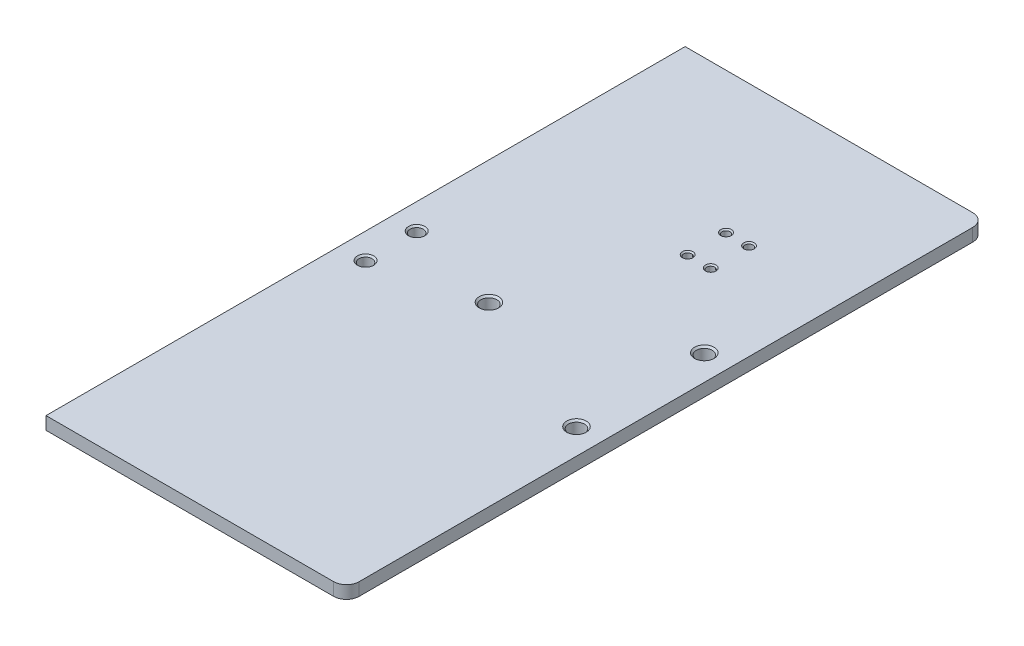
from build123d import *

# Parameters (mm, degrees)
SKETCH_1_W                     = 50
SKETCH_1_H                     = 100
EXTRUDE_1_DEPTH                = 2
SKETCH_2_W                     = 3
SKETCH_2_H                     = 100
EXTRUDE_2_DEPTH                = 80
SKETCH_3_W                     = 2
SKETCH_3_H                     = 66.7
EXTRUDE_3_DEPTH                = 70
CUT_EXTRUDE_4_REACH            = 162.465
SKETCH_8_W                     = 2
SKETCH_8_H                     = 66.7
EXTRUDE_4_DEPTH                = 70
CUT_EXTRUDE_5_REACH            = 140.25
HOLE_WIZARD_M3_1_D             = 2.5
HOLE_WIZARD_M3_1_DEPTH         = 2
HOLE_WIZARD_M3_1_CSINK_D       = 3.05
HOLE_WIZARD_M3_1_CSINK_ANGLE   = 90
FILLET_1_R                     = 2
CUT_EXTRUDE_6_REACH            = 140.25
SKETCH_12_R                    = 11
CUT_EXTRUDE_7_REACH            = 162.465
SKETCH_13_R                    = 14.5
SKETCH_14_W                    = 2
SKETCH_14_H                    = 66.7
EXTRUDE_5_DEPTH                = 70
CUT_EXTRUDE_8_REACH            = 156.14
SKETCH_15_R                    = 5.1
CUT_EXTRUDE_9_DEPTH            = 155.140358116
CUT_EXTRUDE_9_DEPTH_BACK       = 155.140358116
SKETCH_19_W                    = 2
SKETCH_19_H                    = 66.7
CUT_EXTRUDE_10_DEPTH           = 119.844436134
FILLET_2_R                     = 2
HOLE_WIZARD_M3_3_D             = 2.5
HOLE_WIZARD_M3_3_CSINK_D       = 3.05
HOLE_WIZARD_M3_3_CSINK_ANGLE   = 90
CUT_EXTRUDE_11_DEPTH           = 134.88427839
CUT_EXTRUDE_11_DEPTH_BACK      = 134.88427839
SKETCH_28_W                    = 73
SKETCH_28_H                    = 100
HOLE_WIZARD_M2_5_1_D           = 2.05
HOLE_WIZARD_M2_5_1_CSINK_D     = 2.55
HOLE_WIZARD_M2_5_1_CSINK_ANGLE = 90


# Read off the part's stored shape, not the designer's step: M1.6 螺纹孔1, M1.6 螺纹孔2
with BuildPart() as part:
    # 草图1 → 凸台-拉伸1 (new body)
    with BuildSketch(Plane(origin=(0, 0, 0), x_dir=(1, 0, 0), z_dir=(0, 1, 0))):
        Rectangle(SKETCH_1_W, SKETCH_1_H)
    extrude(amount=EXTRUDE_1_DEPTH)

    # 草图2 → 凸台-拉伸2 (add)
    with BuildSketch(Plane(origin=(0, 2, 0), x_dir=(1, 0, 0), z_dir=(0, 1, 0))):
        with Locations((-23.5, 0)):
            Rectangle(SKETCH_2_W, SKETCH_2_H)
    extrude(amount=EXTRUDE_2_DEPTH)

    # 草图3 → 凸台-拉伸3 (add)
    with BuildSketch(Plane.ZY.offset(25)):
        with Locations((-49, 48.65)):
            Rectangle(SKETCH_3_W, SKETCH_3_H)
    extrude(amount=EXTRUDE_3_DEPTH)

    # 草图4 → 切除-拉伸4 (cut, up to next)
    with BuildSketch(Plane(origin=(0, 0, -50), x_dir=(-1, 0, 0), z_dir=(0, 0, -1)), mode=Mode.PRIVATE) as cut_extrude_4_sk1:
        with BuildLine():
            Line((95, 82), (61.65, 82))
            ThreePointArc((61.65, 82), (85.232011153, 72.232011153), (95, 48.65))
            Line((95, 48.65), (95, 82))
        make_face()
    cut_extrude_4_tool1 = extrude(cut_extrude_4_sk1.sketch, amount=-CUT_EXTRUDE_4_REACH, mode=Mode.PRIVATE) & part.part
    # 草图4 → 切除-拉伸4 (cut, up to next)
    with BuildSketch(Plane(origin=(0, 0, -50), x_dir=(-1, 0, 0), z_dir=(0, 0, -1)), mode=Mode.PRIVATE) as cut_extrude_4_sk2:
        with BuildLine():
            ThreePointArc((95, 48.65), (85.232011153, 25.067988847), (61.65, 15.3))
            Line((61.65, 15.3), (95, 15.3))
            Line((95, 15.3), (95, 48.65))
        make_face()
    cut_extrude_4_tool2 = extrude(cut_extrude_4_sk2.sketch, amount=-CUT_EXTRUDE_4_REACH, mode=Mode.PRIVATE) & part.part
    add(cut_extrude_4_tool1.solids().sort_by_distance((-87.550679, 74.550679, -50))[0], mode=Mode.SUBTRACT)
    add(cut_extrude_4_tool2.solids().sort_by_distance((-87.550679, 22.749321, -50))[0], mode=Mode.SUBTRACT)

    # 草图8 → 凸台-拉伸4 (add)
    with BuildSketch(Plane.ZY.offset(25)):
        with Locations((7, 48.65)):
            Rectangle(SKETCH_8_W, SKETCH_8_H)
    extrude(amount=EXTRUDE_4_DEPTH)

    # 草图9 → 切除-拉伸5 (cut, up to next)
    with BuildSketch(Plane.XY.offset(8), mode=Mode.PRIVATE) as cut_extrude_5_sk1:
        with BuildLine():
            ThreePointArc((-95, 48.65), (-85.232011153, 72.232011153), (-61.65, 82))
            Line((-61.65, 82), (-95, 82))
            Line((-95, 82), (-95, 48.65))
        make_face()
    cut_extrude_5_tool1 = extrude(cut_extrude_5_sk1.sketch, amount=-CUT_EXTRUDE_5_REACH, mode=Mode.PRIVATE) & part.part
    # 草图9 → 切除-拉伸5 (cut, up to next)
    with BuildSketch(Plane.XY.offset(8), mode=Mode.PRIVATE) as cut_extrude_5_sk2:
        with BuildLine():
            ThreePointArc((-61.65, 15.3), (-85.232011153, 25.067988847), (-95, 48.65))
            Line((-95, 48.65), (-95, 15.3))
            Line((-95, 15.3), (-61.65, 15.3))
        make_face()
    cut_extrude_5_tool2 = extrude(cut_extrude_5_sk2.sketch, amount=-CUT_EXTRUDE_5_REACH, mode=Mode.PRIVATE) & part.part
    add(cut_extrude_5_tool1.solids().sort_by_distance((-87.550679, 74.550679, 8))[0], mode=Mode.SUBTRACT)
    add(cut_extrude_5_tool2.solids().sort_by_distance((-87.550679, 22.749321, 8))[0], mode=Mode.SUBTRACT)

    # M3 螺纹孔1
    with Locations(Plane.XY.offset(8)):
        with Locations((-78.970508076, 38.65), (-61.65, 68.65), (-44.329491924, 38.65)):
            CounterSinkHole(HOLE_WIZARD_M3_1_D / 2, HOLE_WIZARD_M3_1_CSINK_D / 2, depth=HOLE_WIZARD_M3_1_DEPTH, counter_sink_angle=HOLE_WIZARD_M3_1_CSINK_ANGLE)

    # 圆角1
    fillet_1_edges = [part.edges().sort_by_distance(p)[0] for p in [
        (-23.5, 82, 50),
        (25, 1, 50),
        (25, 1, -50),
    ]]
    fillet(fillet_1_edges, radius=FILLET_1_R)

    # 草图12 → 切除-拉伸6 (cut, up to next)
    with BuildSketch(Plane.XY.offset(8), mode=Mode.PRIVATE) as cut_extrude_6_sk1:
        with Locations((-61.65, 48.65)):
            Circle(SKETCH_12_R)
    cut_extrude_6_tool1 = extrude(cut_extrude_6_sk1.sketch, amount=-CUT_EXTRUDE_6_REACH, mode=Mode.PRIVATE) & part.part
    add(cut_extrude_6_tool1.solids().sort_by_distance((-61.65, 48.65, 8))[0], mode=Mode.SUBTRACT)

    # 草图13 → 切除-拉伸7 (cut, up to next)
    with BuildSketch(Plane(origin=(0, 0, -50), x_dir=(-1, 0, 0), z_dir=(0, 0, -1)), mode=Mode.PRIVATE) as cut_extrude_7_sk1:
        with Locations((61.65, 48.65)):
            Circle(SKETCH_13_R)
    cut_extrude_7_tool1 = extrude(cut_extrude_7_sk1.sketch, amount=-CUT_EXTRUDE_7_REACH, mode=Mode.PRIVATE) & part.part
    add(cut_extrude_7_tool1.solids().sort_by_distance((-61.65, 48.65, -50))[0], mode=Mode.SUBTRACT)

    # 草图14 → 凸台-拉伸5 (add)
    with BuildSketch(Plane.ZY.offset(25)):
        with Locations((-38.5, 48.65)):
            Rectangle(SKETCH_14_W, SKETCH_14_H)
    extrude(amount=EXTRUDE_5_DEPTH)

    # 草图15 → 切除-拉伸8 (cut, up to next)
    with BuildSketch(Plane(origin=(0, 0, -39.5), x_dir=(-1, 0, 0), z_dir=(0, 0, -1)), mode=Mode.PRIVATE) as cut_extrude_8_sk1:
        with Locations(Location((61.65, 48.65, 0), (0, 0, 90))):
            Circle(SKETCH_15_R)
    cut_extrude_8_tool1 = extrude(cut_extrude_8_sk1.sketch, amount=-CUT_EXTRUDE_8_REACH, mode=Mode.PRIVATE) & part.part
    add(cut_extrude_8_tool1.solids().sort_by_distance((-61.65, 48.65, -39.5))[0], mode=Mode.SUBTRACT)

    # 草图18 → 切除-拉伸9 (cut, two sides: drawn at the far end of the back side and taken through both)
    with BuildSketch(Plane(origin=(0, 0, -39.5), x_dir=(-1, 0, 0), z_dir=(0, 0, -1)).offset(-CUT_EXTRUDE_9_DEPTH_BACK)):
        with BuildLine():
            Line((95, 15.3), (95, 48.65))
            ThreePointArc((95, 48.65), (85.232011153, 25.067988847), (61.65, 15.3))
            Line((61.65, 15.3), (95, 15.3))
        make_face()
        with BuildLine():
            Line((95, 48.65), (95, 82))
            Line((95, 82), (61.65, 82))
            ThreePointArc((61.65, 82), (85.232011153, 72.232011153), (95, 48.65))
        make_face()
    extrude(amount=CUT_EXTRUDE_9_DEPTH + CUT_EXTRUDE_9_DEPTH_BACK, mode=Mode.SUBTRACT)

    # 草图19 → 切除-拉伸10 (cut, through all)
    with BuildSketch(Plane.ZY.offset(25)):
        with Locations((-49, 48.65)):
            Rectangle(SKETCH_19_W, SKETCH_19_H)
    extrude(amount=CUT_EXTRUDE_10_DEPTH, mode=Mode.SUBTRACT)

    # 圆角2
    fillet_2_edges = [part.edges().sort_by_distance(p)[0] for p in [
        (-23.5, 82, -50),
    ]]
    fillet(fillet_2_edges, radius=FILLET_2_R)

    # M3 螺纹孔3 (through all)
    with Locations(Plane(origin=(0, 2, 0), x_dir=(1, 0, 0), z_dir=(0, 1, 0))):
        with Locations((-2.7, 0), (21, 10), (21, -10)):
            CounterSinkHole(HOLE_WIZARD_M3_3_D / 2, HOLE_WIZARD_M3_3_CSINK_D / 2, counter_sink_angle=HOLE_WIZARD_M3_3_CSINK_ANGLE)

    # M1.6 螺纹孔1 outline → M1.6 螺纹孔1 (revolve, cut)
    with BuildSketch(Plane(origin=(10, 0, -28), x_dir=(1, 0, 0), z_dir=(0, 0, 1))):
        Polygon((0, 0), (0.625, 0), (0.625, 1.8), (0.825, 2), (0, 2), align=None)
    revolve(axis=Axis((10, 0, -28), (0, 1, 0)), mode=Mode.SUBTRACT)

    # Hole Wizard M1.6 _1 2 outline → Hole Wizard M1.6 _1 2 (revolve, cut)
    with BuildSketch(Plane(origin=(6.4, 0, -28), x_dir=(1, 0, 0), z_dir=(0, 0, 1))):
        Polygon((0, 0), (0.625, 0), (0.625, 1.8), (0.825, 2), (0, 2), align=None)
    revolve(axis=Axis((6.4, 0, -28), (0, 1, 0)), mode=Mode.SUBTRACT)

    # M1.6 螺纹孔2 outline → M1.6 螺纹孔2 (revolve, cut)
    with BuildSketch(Plane(origin=(10, 0, -22), x_dir=(1, 0, 0), z_dir=(0, 0, 1))):
        Polygon((0, 0), (0.625, 0), (0.625, 1.8), (0.825, 2), (0, 2), align=None)
    revolve(axis=Axis((10, 0, -22), (0, 1, 0)), mode=Mode.SUBTRACT)

    # Hole Wizard M1.6 _2 2 outline → Hole Wizard M1.6 _2 2 (revolve, cut)
    with BuildSketch(Plane(origin=(6.4, 0, -22), x_dir=(1, 0, 0), z_dir=(0, 0, 1))):
        Polygon((0, 0), (0.625, 0), (0.625, 1.8), (0.825, 2), (0, 2), align=None)
    revolve(axis=Axis((6.4, 0, -22), (0, 1, 0)), mode=Mode.SUBTRACT)

    # 草图28 → 切除-拉伸11 (cut, two sides: drawn at the far end of the back side and taken through both)
    with BuildSketch(Plane(origin=(0, 2, 0), x_dir=(1, 0, 0), z_dir=(0, 1, 0)).offset(-CUT_EXTRUDE_11_DEPTH_BACK)):
        with Locations((-58.5, 0)):
            Rectangle(SKETCH_28_W, SKETCH_28_H)
    extrude(amount=CUT_EXTRUDE_11_DEPTH + CUT_EXTRUDE_11_DEPTH_BACK, mode=Mode.SUBTRACT)

    # M2.5 螺纹孔1 (through all)
    with Locations(Plane(origin=(0, 2, 0), x_dir=(1, 0, 0), z_dir=(0, 1, 0))):
        with Locations((-18, 4), (-18, -4)):
            CounterSinkHole(HOLE_WIZARD_M2_5_1_D / 2, HOLE_WIZARD_M2_5_1_CSINK_D / 2, counter_sink_angle=HOLE_WIZARD_M2_5_1_CSINK_ANGLE)


solid = part.part
